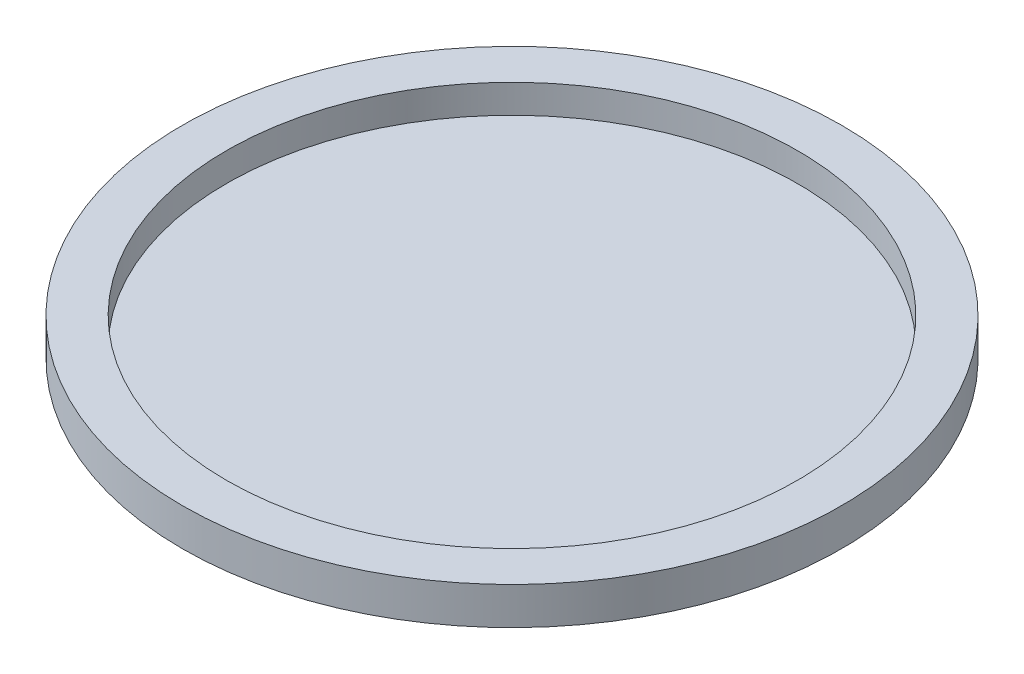
from build123d import *

# Parameters (mm, degrees)
SKETCH_1_R          = 15
EXTRUDE_1_DEPTH     = 1.7
SKETCH_2_R          = 13.403606185
EXTRUDE_2_DEPTH     = 1.2
FILLET_1_R          = 1
SKETCH_4_R          = 7.153275754
EXTRUDE_3_DEPTH     = 2.1
SKETCH_6_R          = 12.998633497
CUT_EXTRUDE_4_DEPTH = 1.3


with BuildPart() as part:
    # Эскиз1 → Бобышка-Вытянуть1 (new body)
    with BuildSketch(Plane(origin=(0, 0, 0), x_dir=(1, 0, 0), z_dir=(0, 1, 0))):
        Circle(SKETCH_1_R)
    extrude(amount=EXTRUDE_1_DEPTH)

    # Эскиз2 → Бобышка-Вытянуть2 (add)
    with BuildSketch(Plane.XZ):
        Circle(SKETCH_2_R)
    extrude(amount=EXTRUDE_2_DEPTH)

    # Скругление1
    fillet_1_edges = [part.edges().sort_by_distance(p)[0] for p in [
        (-13.403606185, -1.2, 0),
    ]]
    fillet(fillet_1_edges, radius=FILLET_1_R)

    # Эскиз4 → Бобышка-Вытянуть3 (add)
    with BuildSketch(Plane.XZ.offset(1.2)):
        Circle(SKETCH_4_R)
    extrude(amount=EXTRUDE_3_DEPTH)

    # Эскиз6 → Вырез-Вытянуть4 (cut)
    with BuildSketch(Plane(origin=(0, 1.7, 0), x_dir=(1, 0, 0), z_dir=(0, 1, 0))):
        Circle(SKETCH_6_R)
    extrude(amount=-CUT_EXTRUDE_4_DEPTH, mode=Mode.SUBTRACT)


solid = part.part
